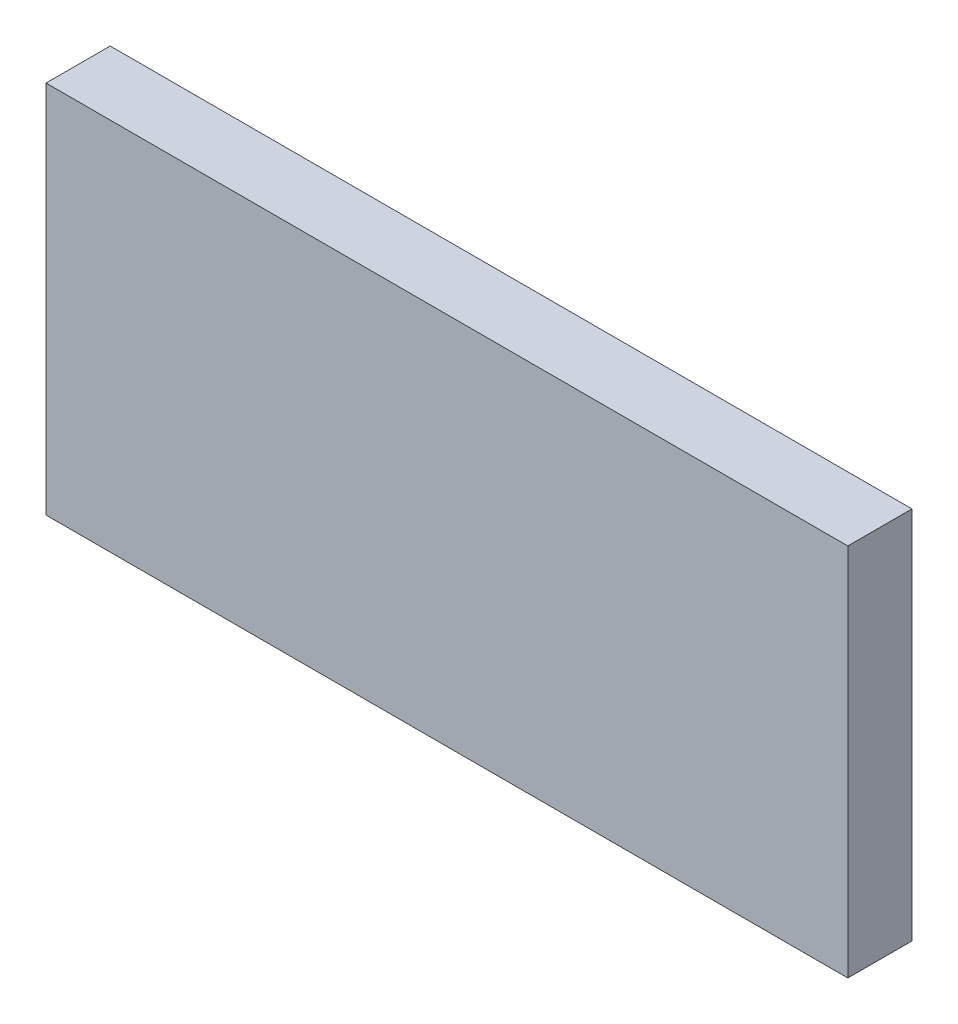
from build123d import *

# Parameters (mm, degrees)
SKETCH1_W           = 150
SKETCH1_H           = 70
BOSS_EXTRUDE1_DEPTH = 12


with BuildPart() as part:
    # Sketch1 → Boss-Extrude1 (new body)
    with BuildSketch(Plane.XY):
        with Locations((75, 35)):
            Rectangle(SKETCH1_W, SKETCH1_H)
    extrude(amount=BOSS_EXTRUDE1_DEPTH)


solid = part.part
